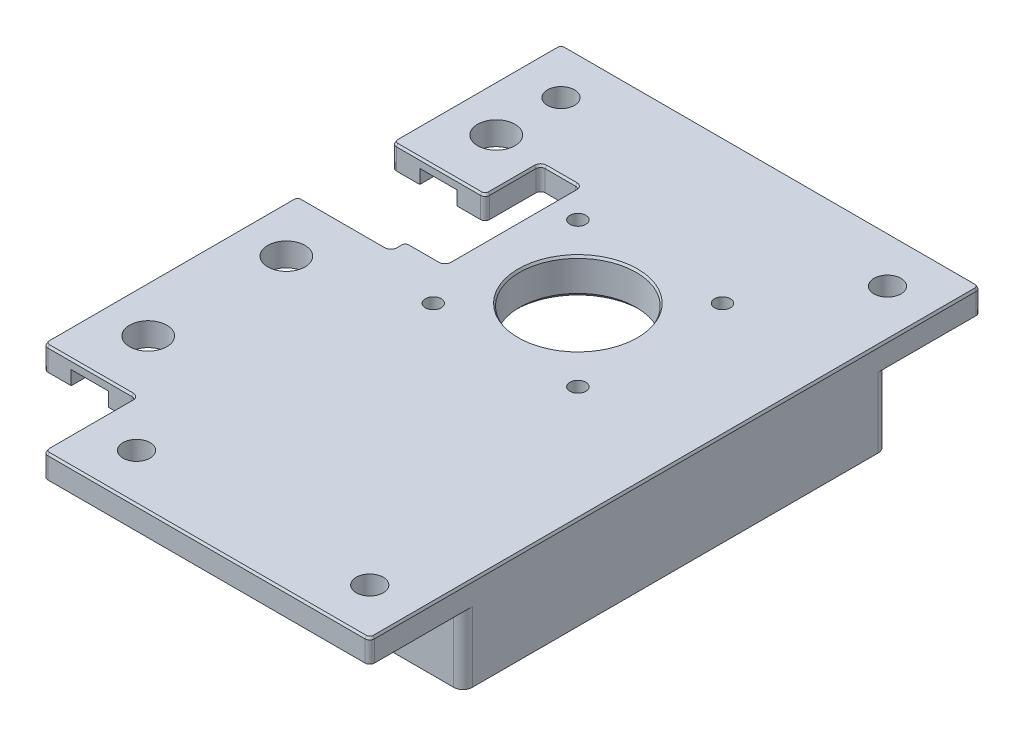
from build123d import *
from OCP.BRepFilletAPI import BRepFilletAPI_MakeChamfer

# Parameters (mm, degrees)
SKETCH1_W                  = 90
SKETCH1_H                  = 131
BOSS_EXTRUDE1_DEPTH        = 5
CUT_EXTRUDE1_REACH         = 161.016
SKETCH2_R                  = 12.5
SKETCH2_R_2                = 1.7
SKETCH2_W                  = 20
SKETCH2_H                  = 20
M5_CLEARANCE_HOLE1_D       = 5.8
SKETCH6_R                  = 4
CUT_EXTRUDE2_DEPTH         = 10
MOVE_FACE1_BY              = 0.1
MOVE_FACE1_2_BY            = 0.1
BOSS_EXTRUDE2_DEPTH        = 15
FILLET4_R                  = 3
FILLET5_R                  = 2
CUT_EXTRUDE5_DEPTH         = 4
CUT_EXTRUDE5_DEPTH_BACK    = 4
SKETCH11_W                 = 8.5
SKETCH11_H                 = 15
CUT_EXTRUDE6_DEPTH         = 161.190511579
FILLET6_R                  = 1
SKETCH15_R                 = 1.7
SKETCH15_R_2               = 12.5
BOSS_EXTRUDE3_DEPTH        = 3
CHAMFER1_SIZE              = 1
PRINTABILITY_CHAMFER_SIZE  = 0.5
PRINTABILITY_CHAMFER_SIZE2 = 0.288675135
SKETCH12_W                 = 0.325641026
SKETCH12_H                 = 1.221153846
LEFT_PART_NUM_DEPTH        = 0.4


# Some blends are built 0.0001 mm under size
with BuildPart() as part:
    # Sketch1 → Boss-Extrude1 (new body)
    with BuildSketch(Plane(origin=(0, 0, 0), x_dir=(1, 0, 0), z_dir=(0, 1, 0))):
        with Locations((45, 65.5)):
            Rectangle(SKETCH1_W, SKETCH1_H)
    extrude(amount=BOSS_EXTRUDE1_DEPTH)

    # Sketch2 → Cut-Extrude1 (cut, up to next)
    with BuildSketch(Plane(origin=(0, 5, 0), x_dir=(1, 0, 0), z_dir=(0, 1, 0)), mode=Mode.PRIVATE) as cut_extrude1_sk1:
        with Locations(Location((50, 84.625, 0), (0, 0, 270))):
            Circle(SKETCH2_R)
    cut_extrude1_tool1 = extrude(cut_extrude1_sk1.sketch, amount=-CUT_EXTRUDE1_REACH, mode=Mode.PRIVATE) & part.part
    # Sketch2 → Cut-Extrude1 (cut, up to next)
    with BuildSketch(Plane(origin=(0, 5, 0), x_dir=(1, 0, 0), z_dir=(0, 1, 0)), mode=Mode.PRIVATE) as cut_extrude1_sk2:
        with Locations(Location((65.5, 100.125, 0), (0, 0, 270))):
            Circle(SKETCH2_R_2)
    cut_extrude1_tool2 = extrude(cut_extrude1_sk2.sketch, amount=-CUT_EXTRUDE1_REACH, mode=Mode.PRIVATE) & part.part
    # Sketch2 → Cut-Extrude1 (cut, up to next)
    with BuildSketch(Plane(origin=(0, 5, 0), x_dir=(1, 0, 0), z_dir=(0, 1, 0)), mode=Mode.PRIVATE) as cut_extrude1_sk3:
        with Locations(Location((34.5, 100.125, 0), (0, 0, 270))):
            Circle(SKETCH2_R_2)
    cut_extrude1_tool3 = extrude(cut_extrude1_sk3.sketch, amount=-CUT_EXTRUDE1_REACH, mode=Mode.PRIVATE) & part.part
    # Sketch2 → Cut-Extrude1 (cut, up to next)
    with BuildSketch(Plane(origin=(0, 5, 0), x_dir=(1, 0, 0), z_dir=(0, 1, 0)), mode=Mode.PRIVATE) as cut_extrude1_sk4:
        with Locations(Location((65.5, 69.125, 0), (0, 0, 270))):
            Circle(SKETCH2_R_2)
    cut_extrude1_tool4 = extrude(cut_extrude1_sk4.sketch, amount=-CUT_EXTRUDE1_REACH, mode=Mode.PRIVATE) & part.part
    # Sketch2 → Cut-Extrude1 (cut, up to next)
    with BuildSketch(Plane(origin=(0, 5, 0), x_dir=(1, 0, 0), z_dir=(0, 1, 0)), mode=Mode.PRIVATE) as cut_extrude1_sk5:
        with Locations(Location((34.5, 69.125, 0), (0, 0, 270))):
            Circle(SKETCH2_R_2)
    cut_extrude1_tool5 = extrude(cut_extrude1_sk5.sketch, amount=-CUT_EXTRUDE1_REACH, mode=Mode.PRIVATE) & part.part
    # Sketch2 → Cut-Extrude1 (cut, up to next)
    with BuildSketch(Plane(origin=(0, 5, 0), x_dir=(1, 0, 0), z_dir=(0, 1, 0)), mode=Mode.PRIVATE) as cut_extrude1_sk6:
        Polygon((0, 94.625), (20, 94.625), (20, 91.625), (28.5, 91.625), (28.5, 77.625), (20, 77.625), (20, 74.625), (0, 74.625), align=None)
    cut_extrude1_tool6 = extrude(cut_extrude1_sk6.sketch, amount=-CUT_EXTRUDE1_REACH, mode=Mode.PRIVATE) & part.part
    # Sketch2 → Cut-Extrude1 (cut, up to next)
    with BuildSketch(Plane(origin=(0, 5, 0), x_dir=(1, 0, 0), z_dir=(0, 1, 0)), mode=Mode.PRIVATE) as cut_extrude1_sk7:
        with Locations((10, 10)):
            Rectangle(SKETCH2_W, SKETCH2_H)
    cut_extrude1_tool7 = extrude(cut_extrude1_sk7.sketch, amount=-CUT_EXTRUDE1_REACH, mode=Mode.PRIVATE) & part.part
    add(cut_extrude1_tool1.solids().sort_by_distance((50, 5, -84.625))[0], mode=Mode.SUBTRACT)
    add(cut_extrude1_tool2.solids().sort_by_distance((65.5, 5, -100.125))[0], mode=Mode.SUBTRACT)
    add(cut_extrude1_tool3.solids().sort_by_distance((34.5, 5, -100.125))[0], mode=Mode.SUBTRACT)
    add(cut_extrude1_tool4.solids().sort_by_distance((65.5, 5, -69.125))[0], mode=Mode.SUBTRACT)
    add(cut_extrude1_tool5.solids().sort_by_distance((34.5, 5, -69.125))[0], mode=Mode.SUBTRACT)
    add(cut_extrude1_tool6.solids().sort_by_distance((13.267341, 5, -84.625))[0], mode=Mode.SUBTRACT)
    add(cut_extrude1_tool7.solids().sort_by_distance((10, 5, -10))[0], mode=Mode.SUBTRACT)

    # M5 Clearance Hole1 (through all)
    with Locations(Plane(origin=(0, 5, 0), x_dir=(1, 0, 0), z_dir=(0, 1, 0))):
        with Locations((80, 10), (10, 121), (80, 121), (30, 10)):
            Hole(M5_CLEARANCE_HOLE1_D / 2)

    # Sketch6 → Cut-Extrude2 (cut)
    with BuildSketch(Plane(origin=(0, 0, 0), x_dir=(-1, 0, 0), z_dir=(0, -1, 0))):
        with Locations(Location((-10, 32.5, 0), (0, 0, 90))):
            Circle(SKETCH6_R)
        with Locations(Location((-10, 62.125, 0), (0, 0, 90))):
            Circle(SKETCH6_R)
        with Locations(Location((-10, 107.125, 0), (0, 0, 90))):
            Circle(SKETCH6_R)
    extrude(amount=-CUT_EXTRUDE2_DEPTH, mode=Mode.SUBTRACT)

    # Move Face1: a face moved inward by 0.1
    extrude(part.faces().sort_by_distance((10, 2.5, -94.625))[0], amount=MOVE_FACE1_BY, dir=(0, 0, -1), mode=Mode.SUBTRACT)

    # Move Face1 2: a face moved inward by 0.1
    extrude(part.faces().sort_by_distance((10, 2.5, -74.625))[0], amount=MOVE_FACE1_2_BY, dir=(0, 0, 1), mode=Mode.SUBTRACT)

    # Sketch9 → Boss-Extrude2 (add)
    with BuildSketch(Plane.XZ):
        Polygon((90, -111), (90, -20), (20, -20), (20, -74.525), (25, -74.525), (25, -25), (85, -25), (85, -106), (71, -106), (71, -111), align=None)
    extrude(amount=BOSS_EXTRUDE2_DEPTH)

    # Fillet4
    fillet4_edges = [part.edges().sort_by_distance(p)[0] for p in [
        (25, -7.5, -25),
        (85, -7.5, -25),
        (85, -7.5, -106),
    ]]
    fillet(fillet4_edges, radius=FILLET4_R)

    # Fillet5
    # the kernel refuses this fillet: 2 mm, written as the material it takes off along each edge
    with BuildSketch(Plane(origin=(71, 0, -111), x_dir=(0, 0, 1), z_dir=(0, -1, 0)), Plane(origin=(90, 0, -111), x_dir=(-1, 0, 0), z_dir=(0, -1, 0)), Plane(origin=(90, 0, -20), x_dir=(0, 0, -1), z_dir=(0, -1, 0)), Plane(origin=(20, 0, -20), x_dir=(1, 0, 0), z_dir=(0, -1, 0)), Plane(origin=(71, 0, -106), x_dir=(1, 0, 0), z_dir=(0, -1, 0))) as fillet5_piece_1:
        with BuildLine():
            CenterArc((FILLET5_R, -FILLET5_R), FILLET5_R, 90, 90)
            Line((0, -FILLET5_R), (0, 0))
            Line((0, 0), (FILLET5_R, 0))
        make_face()
    extrude(amount=20, mode=Mode.SUBTRACT)
    with BuildSketch(Plane(origin=(20, 0, -74.525), x_dir=(1, 0, 0), z_dir=(0, -1, 0)), Plane(origin=(25, 0, -74.525), x_dir=(0, 0, 1), z_dir=(0, -1, 0))) as fillet5_piece_2:
        with BuildLine():
            CenterArc((FILLET5_R, FILLET5_R), FILLET5_R, 180, 90)
            Line((0, FILLET5_R), (0, 0))
            Line((0, 0), (FILLET5_R, 0))
        make_face()
    extrude(amount=20, mode=Mode.SUBTRACT)

    # Sketch10 → Cut-Extrude5 (cut, two sides: drawn at the far end of the back side and taken through both)
    with BuildSketch(Plane.ZY.offset(-10).offset(-CUT_EXTRUDE5_DEPTH_BACK)):
        Polygon((-74.525, 0), (-74.525, 3), (-71.525, 0), align=None)
        Polygon((-97.725, 0), (-94.725, 0), (-94.725, 3), align=None)
        Polygon((-20, 0), (-23, 0), (-20, 3), align=None)
    extrude(amount=CUT_EXTRUDE5_DEPTH + CUT_EXTRUDE5_DEPTH_BACK, mode=Mode.SUBTRACT)

    # Sketch11 → Cut-Extrude6 (cut, through all)
    with BuildSketch(Plane(origin=(0, 5, 0), x_dir=(1, 0, 0), z_dir=(0, 1, 0))):
        with Locations((24.25, 99.125)):
            Rectangle(SKETCH11_W, SKETCH11_H)
    extrude(amount=-CUT_EXTRUDE6_DEPTH, mode=Mode.SUBTRACT)

    # Fillet6
    fillet6_edges = [part.edges().sort_by_distance(p)[0] for p in [
        (20, 2.5, -106.625),
        (28.5, 2.5, -106.625),
        (0, 2.5, -20),
        (20, 2.5, -20),
        (20, 2.5, 0),
        (0, 2.5, -74.525),
        (0, 2.5, -94.725),
        (20, 2.5, -94.725),
        (28.5, 2.5, -77.625),
        (20, 2.5, -77.625),
        (20, 2.5, -74.525),
        (0, 2.5, -131),
        (90, 2.5, -131),
        (90, 2.5, 0),
    ]]
    fillet(fillet6_edges, radius=FILLET6_R)

    # Sketch15 → Boss-Extrude3 (add)
    with BuildSketch(Plane.XZ):
        with BuildLine():
            Line((29.5, -100.125), (29.5, -69.125))
            ThreePointArc((29.5, -69.125), (30.964466094, -65.589466094), (34.5, -64.125))
            Line((34.5, -64.125), (65.5, -64.125))
            ThreePointArc((65.5, -64.125), (69.035533906, -65.589466094), (70.5, -69.125))
            Line((70.5, -69.125), (70.5, -100.125))
            ThreePointArc((70.5, -100.125), (69.035533906, -103.660533906), (65.5, -105.125))
            Line((65.5, -105.125), (34.5, -105.125))
            ThreePointArc((34.5, -105.125), (30.964466094, -103.660533906), (29.5, -100.125))
        make_face()
        with Locations(Location((65.5, -100.125, 0), (0, 0, 90))):
            Circle(SKETCH15_R, mode=Mode.SUBTRACT)
        with Locations(Location((34.5, -100.125, 0), (0, 0, 90))):
            Circle(SKETCH15_R, mode=Mode.SUBTRACT)
        with Locations(Location((65.5, -69.125, 0), (0, 0, 90))):
            Circle(SKETCH15_R, mode=Mode.SUBTRACT)
        with Locations(Location((34.5, -69.125, 0), (0, 0, 90))):
            Circle(SKETCH15_R, mode=Mode.SUBTRACT)
        with Locations(Location((50, -84.625, 0), (0, 0, 90))):
            Circle(SKETCH15_R_2, mode=Mode.SUBTRACT)
    extrude(amount=BOSS_EXTRUDE3_DEPTH)

    # Chamfer1
    chamfer1_edges = [part.edges().sort_by_distance(p)[0] for p in [
        (30.964466094, 0, -103.660533906),
        (50, 0, -105.125),
        (69.035533906, 0, -103.660533906),
        (70.5, 0, -84.625),
        (69.035533906, 0, -65.589466094),
        (50, 0, -64.125),
        (30.964466094, 0, -65.589466094),
        (29.5, 0, -84.625),
        (50, -3, -97.125),
    ]]
    chamfer(chamfer1_edges, length=CHAMFER1_SIZE - 0.0001)  # a hair under: the kernel refuses the full size

    # Printability Chamfer: one chamfer whose edges measure the first distance from different faces: ONE call of the kernel's chamfer builder (chamfer() names one face for all edges)
    printability_chamfer_edges_1 = [part.edges().sort_by_distance(p)[0] for p in [
        (24.25, 5, -77.625),
    ]]
    printability_chamfer_side_1 = [part.faces().sort_by_distance(p)[0] for p in [
        (24.25, 2.5, -77.625),
    ]]
    printability_chamfer_edges_2 = [part.edges().sort_by_distance(p)[0] for p in [
        (10, 5, -94.725),
    ]]
    printability_chamfer_side_2 = [part.faces().sort_by_distance(p)[0] for p in [
        (10, 4.813184583, -94.725),
    ]]
    printability_chamfer_edges_3 = [part.edges().sort_by_distance(p)[0] for p in [
        (20, 5, -100.675),
    ]]
    printability_chamfer_side_3 = [part.faces().sort_by_distance(p)[0] for p in [
        (20, 2.5, -100.675),
    ]]
    printability_chamfer_edges_4 = [part.edges().sort_by_distance(p)[0] for p in [
        (24.25, 5, -106.625),
    ]]
    printability_chamfer_side_4 = [part.faces().sort_by_distance(p)[0] for p in [
        (24.25, 2.5, -106.625),
    ]]
    printability_chamfer_edges_5 = [part.edges().sort_by_distance(p)[0] for p in [
        (28.5, 5, -92.125),
    ]]
    printability_chamfer_side_5 = [part.faces().sort_by_distance(p)[0] for p in [
        (28.5, 2.5, -92.125),
    ]]
    printability_chamfer_edges_6 = [part.edges().sort_by_distance(p)[0] for p in [
        (20, 5, -76.075),
    ]]
    printability_chamfer_side_6 = [part.faces().sort_by_distance(p)[0] for p in [
        (20, 2.5, -76.075),
    ]]
    printability_chamfer_edges_7 = [part.edges().sort_by_distance(p)[0] for p in [
        (10, 5, -74.525),
    ]]
    printability_chamfer_side_7 = [part.faces().sort_by_distance(p)[0] for p in [
        (10, 4.813184583, -74.525),
    ]]
    printability_chamfer_edges_8 = [part.edges().sort_by_distance(p)[0] for p in [
        (0, 5, -47.2625),
    ]]
    printability_chamfer_side_8 = [part.faces().sort_by_distance(p)[0] for p in [
        (0, 2.5, -47.2625),
    ]]
    printability_chamfer_edges_9 = [part.edges().sort_by_distance(p)[0] for p in [
        (10, 5, -20),
    ]]
    printability_chamfer_side_9 = [part.faces().sort_by_distance(p)[0] for p in [
        (10, 4.813184583, -20),
    ]]
    printability_chamfer_edges_10 = [part.edges().sort_by_distance(p)[0] for p in [
        (20, 5, -10),
    ]]
    printability_chamfer_side_10 = [part.faces().sort_by_distance(p)[0] for p in [
        (20, 2.5, -10),
    ]]
    printability_chamfer_edges_11 = [part.edges().sort_by_distance(p)[0] for p in [
        (55, 5, 0),
    ]]
    printability_chamfer_side_11 = [part.faces().sort_by_distance(p)[0] for p in [
        (55, 2.5, 0),
    ]]
    printability_chamfer_edges_12 = [part.edges().sort_by_distance(p)[0] for p in [
        (90, 5, -65.5),
    ]]
    printability_chamfer_side_12 = [part.faces().sort_by_distance(p)[0] for p in [
        (90, -4.192307692, -65.5),
    ]]
    printability_chamfer_edges_13 = [part.edges().sort_by_distance(p)[0] for p in [
        (45, 5, -131),
    ]]
    printability_chamfer_side_13 = [part.faces().sort_by_distance(p)[0] for p in [
        (45, 2.5, -131),
    ]]
    printability_chamfer_edges_14 = [part.edges().sort_by_distance(p)[0] for p in [
        (0, 5, -112.8625),
    ]]
    printability_chamfer_side_14 = [part.faces().sort_by_distance(p)[0] for p in [
        (0, 2.5, -112.8625),
    ]]
    printability_chamfer_edges_15 = [part.edges().sort_by_distance(p)[0] for p in [
        (20.292893219, 5, -0.292893219),
    ]]
    printability_chamfer_side_15 = [part.faces().sort_by_distance(p)[0] for p in [
        (20.292893219, 2.5, -0.292893219),
    ]]
    printability_chamfer_edges_16 = [part.edges().sort_by_distance(p)[0] for p in [
        (0.292893219, 5, -20.292893219),
    ]]
    printability_chamfer_side_16 = [part.faces().sort_by_distance(p)[0] for p in [
        (0.292893219, 2.5, -20.292893219),
    ]]
    printability_chamfer_edges_17 = [part.edges().sort_by_distance(p)[0] for p in [
        (0.292893219, 5, -74.232106781),
    ]]
    printability_chamfer_side_17 = [part.faces().sort_by_distance(p)[0] for p in [
        (0.292893219, 2.5, -74.232106781),
    ]]
    printability_chamfer_edges_18 = [part.edges().sort_by_distance(p)[0] for p in [
        (0.292893219, 5, -95.017893219),
    ]]
    printability_chamfer_side_18 = [part.faces().sort_by_distance(p)[0] for p in [
        (0.292893219, 2.5, -95.017893219),
    ]]
    printability_chamfer_edges_19 = [part.edges().sort_by_distance(p)[0] for p in [
        (0.292893219, 5, -130.707106781),
    ]]
    printability_chamfer_side_19 = [part.faces().sort_by_distance(p)[0] for p in [
        (0.292893219, 2.5, -130.707106781),
    ]]
    printability_chamfer_edges_20 = [part.edges().sort_by_distance(p)[0] for p in [
        (89.707106781, 5, -130.707106781),
    ]]
    printability_chamfer_side_20 = [part.faces().sort_by_distance(p)[0] for p in [
        (89.707106781, 2.5, -130.707106781),
    ]]
    printability_chamfer_edges_21 = [part.edges().sort_by_distance(p)[0] for p in [
        (89.707106781, 5, -0.292893219),
    ]]
    printability_chamfer_side_21 = [part.faces().sort_by_distance(p)[0] for p in [
        (89.707106781, 2.5, -0.292893219),
    ]]
    printability_chamfer_edges_22 = [part.edges().sort_by_distance(p)[0] for p in [
        (19.707106781, 5, -95.017893219),
    ]]
    printability_chamfer_side_22 = [part.faces().sort_by_distance(p)[0] for p in [
        (19.707106781, 2.5, -95.017893219),
    ]]
    printability_chamfer_edges_23 = [part.edges().sort_by_distance(p)[0] for p in [
        (20.292893219, 5, -77.332106781),
    ]]
    printability_chamfer_side_23 = [part.faces().sort_by_distance(p)[0] for p in [
        (20.292893219, 2.5, -77.332106781),
    ]]
    printability_chamfer_edges_24 = [part.edges().sort_by_distance(p)[0] for p in [
        (19.707106781, 5, -74.817893219),
    ]]
    printability_chamfer_side_24 = [part.faces().sort_by_distance(p)[0] for p in [
        (19.707106781, 2.5, -74.817893219),
    ]]
    printability_chamfer_edges_25 = [part.edges().sort_by_distance(p)[0] for p in [
        (28.207106781, 5, -77.917893219),
    ]]
    printability_chamfer_side_25 = [part.faces().sort_by_distance(p)[0] for p in [
        (28.207106781, 2.5, -77.917893219),
    ]]
    printability_chamfer_edges_26 = [part.edges().sort_by_distance(p)[0] for p in [
        (28.207106781, 5, -106.332106781),
    ]]
    printability_chamfer_side_26 = [part.faces().sort_by_distance(p)[0] for p in [
        (28.207106781, 2.5, -106.332106781),
    ]]
    printability_chamfer_edges_27 = [part.edges().sort_by_distance(p)[0] for p in [
        (20.292893219, 5, -106.332106781),
    ]]
    printability_chamfer_side_27 = [part.faces().sort_by_distance(p)[0] for p in [
        (20.292893219, 2.5, -106.332106781),
    ]]
    printability_chamfer_edges_28 = [part.edges().sort_by_distance(p)[0] for p in [
        (19.707106781, 5, -19.707106781),
    ]]
    printability_chamfer_side_28 = [part.faces().sort_by_distance(p)[0] for p in [
        (19.707106781, 2.5, -19.707106781),
    ]]
    printability_chamfer_edges_29 = [part.edges().sort_by_distance(p)[0] for p in [
        (50, 5, -97.125),
    ]]
    printability_chamfer_side_29 = [part.faces().sort_by_distance(p)[0] for p in [
        (50, 2.5, -97.125),
    ]]
    printability_chamfer = BRepFilletAPI_MakeChamfer(part.part.solid().wrapped)
    for e in printability_chamfer_edges_1:
        printability_chamfer.Add(PRINTABILITY_CHAMFER_SIZE, PRINTABILITY_CHAMFER_SIZE2, e.wrapped, printability_chamfer_side_1[0].wrapped)  # the first distance lies on this face
    for e in printability_chamfer_edges_2:
        printability_chamfer.Add(PRINTABILITY_CHAMFER_SIZE, PRINTABILITY_CHAMFER_SIZE2, e.wrapped, printability_chamfer_side_2[0].wrapped)  # the first distance lies on this face
    for e in printability_chamfer_edges_3:
        printability_chamfer.Add(PRINTABILITY_CHAMFER_SIZE, PRINTABILITY_CHAMFER_SIZE2, e.wrapped, printability_chamfer_side_3[0].wrapped)  # the first distance lies on this face
    for e in printability_chamfer_edges_4:
        printability_chamfer.Add(PRINTABILITY_CHAMFER_SIZE, PRINTABILITY_CHAMFER_SIZE2, e.wrapped, printability_chamfer_side_4[0].wrapped)  # the first distance lies on this face
    for e in printability_chamfer_edges_5:
        printability_chamfer.Add(PRINTABILITY_CHAMFER_SIZE, PRINTABILITY_CHAMFER_SIZE2, e.wrapped, printability_chamfer_side_5[0].wrapped)  # the first distance lies on this face
    for e in printability_chamfer_edges_6:
        printability_chamfer.Add(PRINTABILITY_CHAMFER_SIZE, PRINTABILITY_CHAMFER_SIZE2, e.wrapped, printability_chamfer_side_6[0].wrapped)  # the first distance lies on this face
    for e in printability_chamfer_edges_7:
        printability_chamfer.Add(PRINTABILITY_CHAMFER_SIZE, PRINTABILITY_CHAMFER_SIZE2, e.wrapped, printability_chamfer_side_7[0].wrapped)  # the first distance lies on this face
    for e in printability_chamfer_edges_8:
        printability_chamfer.Add(PRINTABILITY_CHAMFER_SIZE, PRINTABILITY_CHAMFER_SIZE2, e.wrapped, printability_chamfer_side_8[0].wrapped)  # the first distance lies on this face
    for e in printability_chamfer_edges_9:
        printability_chamfer.Add(PRINTABILITY_CHAMFER_SIZE, PRINTABILITY_CHAMFER_SIZE2, e.wrapped, printability_chamfer_side_9[0].wrapped)  # the first distance lies on this face
    for e in printability_chamfer_edges_10:
        printability_chamfer.Add(PRINTABILITY_CHAMFER_SIZE, PRINTABILITY_CHAMFER_SIZE2, e.wrapped, printability_chamfer_side_10[0].wrapped)  # the first distance lies on this face
    for e in printability_chamfer_edges_11:
        printability_chamfer.Add(PRINTABILITY_CHAMFER_SIZE, PRINTABILITY_CHAMFER_SIZE2, e.wrapped, printability_chamfer_side_11[0].wrapped)  # the first distance lies on this face
    for e in printability_chamfer_edges_12:
        printability_chamfer.Add(PRINTABILITY_CHAMFER_SIZE, PRINTABILITY_CHAMFER_SIZE2, e.wrapped, printability_chamfer_side_12[0].wrapped)  # the first distance lies on this face
    for e in printability_chamfer_edges_13:
        printability_chamfer.Add(PRINTABILITY_CHAMFER_SIZE, PRINTABILITY_CHAMFER_SIZE2, e.wrapped, printability_chamfer_side_13[0].wrapped)  # the first distance lies on this face
    for e in printability_chamfer_edges_14:
        printability_chamfer.Add(PRINTABILITY_CHAMFER_SIZE, PRINTABILITY_CHAMFER_SIZE2, e.wrapped, printability_chamfer_side_14[0].wrapped)  # the first distance lies on this face
    for e in printability_chamfer_edges_15:
        printability_chamfer.Add(PRINTABILITY_CHAMFER_SIZE, PRINTABILITY_CHAMFER_SIZE2, e.wrapped, printability_chamfer_side_15[0].wrapped)  # the first distance lies on this face
    for e in printability_chamfer_edges_16:
        printability_chamfer.Add(PRINTABILITY_CHAMFER_SIZE, PRINTABILITY_CHAMFER_SIZE2, e.wrapped, printability_chamfer_side_16[0].wrapped)  # the first distance lies on this face
    for e in printability_chamfer_edges_17:
        printability_chamfer.Add(PRINTABILITY_CHAMFER_SIZE, PRINTABILITY_CHAMFER_SIZE2, e.wrapped, printability_chamfer_side_17[0].wrapped)  # the first distance lies on this face
    for e in printability_chamfer_edges_18:
        printability_chamfer.Add(PRINTABILITY_CHAMFER_SIZE, PRINTABILITY_CHAMFER_SIZE2, e.wrapped, printability_chamfer_side_18[0].wrapped)  # the first distance lies on this face
    for e in printability_chamfer_edges_19:
        printability_chamfer.Add(PRINTABILITY_CHAMFER_SIZE, PRINTABILITY_CHAMFER_SIZE2, e.wrapped, printability_chamfer_side_19[0].wrapped)  # the first distance lies on this face
    for e in printability_chamfer_edges_20:
        printability_chamfer.Add(PRINTABILITY_CHAMFER_SIZE, PRINTABILITY_CHAMFER_SIZE2, e.wrapped, printability_chamfer_side_20[0].wrapped)  # the first distance lies on this face
    for e in printability_chamfer_edges_21:
        printability_chamfer.Add(PRINTABILITY_CHAMFER_SIZE, PRINTABILITY_CHAMFER_SIZE2, e.wrapped, printability_chamfer_side_21[0].wrapped)  # the first distance lies on this face
    for e in printability_chamfer_edges_22:
        printability_chamfer.Add(PRINTABILITY_CHAMFER_SIZE, PRINTABILITY_CHAMFER_SIZE2, e.wrapped, printability_chamfer_side_22[0].wrapped)  # the first distance lies on this face
    for e in printability_chamfer_edges_23:
        printability_chamfer.Add(PRINTABILITY_CHAMFER_SIZE, PRINTABILITY_CHAMFER_SIZE2, e.wrapped, printability_chamfer_side_23[0].wrapped)  # the first distance lies on this face
    for e in printability_chamfer_edges_24:
        printability_chamfer.Add(PRINTABILITY_CHAMFER_SIZE, PRINTABILITY_CHAMFER_SIZE2, e.wrapped, printability_chamfer_side_24[0].wrapped)  # the first distance lies on this face
    for e in printability_chamfer_edges_25:
        printability_chamfer.Add(PRINTABILITY_CHAMFER_SIZE, PRINTABILITY_CHAMFER_SIZE2, e.wrapped, printability_chamfer_side_25[0].wrapped)  # the first distance lies on this face
    for e in printability_chamfer_edges_26:
        printability_chamfer.Add(PRINTABILITY_CHAMFER_SIZE, PRINTABILITY_CHAMFER_SIZE2, e.wrapped, printability_chamfer_side_26[0].wrapped)  # the first distance lies on this face
    for e in printability_chamfer_edges_27:
        printability_chamfer.Add(PRINTABILITY_CHAMFER_SIZE, PRINTABILITY_CHAMFER_SIZE2, e.wrapped, printability_chamfer_side_27[0].wrapped)  # the first distance lies on this face
    for e in printability_chamfer_edges_28:
        printability_chamfer.Add(PRINTABILITY_CHAMFER_SIZE, PRINTABILITY_CHAMFER_SIZE2, e.wrapped, printability_chamfer_side_28[0].wrapped)  # the first distance lies on this face
    for e in printability_chamfer_edges_29:
        printability_chamfer.Add(PRINTABILITY_CHAMFER_SIZE, PRINTABILITY_CHAMFER_SIZE2, e.wrapped, printability_chamfer_side_29[0].wrapped)  # the first distance lies on this face
    add(Compound.cast(printability_chamfer.Shape()), mode=Mode.REPLACE)

    # Sketch12 → Left Part Num (cut)
    # profile 1 of 6: a face of its own
    with BuildSketch(Plane(origin=(0, 5, 0), x_dir=(0, -1, 0), z_dir=(1, 0, 0))):
        Polygon((1.225, 119.008974359), (1.225, 118.724038462), (4.074358974, 118.724038462), (4.074358974, 117.502884615), (4.4, 117.502884615), (4.4, 119.008974359), align=None)
    # profile 2 of 6: a face of its own
    with BuildSketch(Plane(origin=(0, 5, 0), x_dir=(0, -1, 0), z_dir=(1, 0, 0))):
        Polygon((1.550641026, 117.136538462), (1.225, 117.136538462), (1.225, 115.467628205), (4.074358974, 116.799449119), (4.074358974, 115.508333333), (4.4, 115.508333333), (4.4, 117.258653846), (1.550641026, 115.926832933), align=None)
    # profile 3 of 6: a face of its own
    with BuildSketch(Plane(origin=(0, 5, 0), x_dir=(0, -1, 0), z_dir=(1, 0, 0))):
        with BuildLine():
            Line((1.225, 114.857051282), (1.225, 114.234390024))
            add(Edge.make_bspline(
                [(1.225, 114.234390024), (1.225047077, 114.191562988), (1.22513728, 114.109504484), (1.227872085, 113.991834398), (1.23152487, 113.884964141), (1.236588444, 113.789124153), (1.242572494, 113.70401955), (1.250965415, 113.630035428), (1.259728683, 113.566590259), (1.268638102, 113.528575123), (1.272701322, 113.511237981)],
                knots=[0, 0, 0, 0, 1.415646017, 2.712440637, 3.8905458, 4.950247383, 5.884950622, 6.709939814, 7.411656543, 8, 8, 8, 8], degree=3))
            add(Edge.make_bspline(
                [(1.272701322, 113.511237981), (1.278708612, 113.489291181), (1.290581636, 113.44591473), (1.314357828, 113.383408871), (1.342566417, 113.32395245), (1.374654318, 113.267280097), (1.412201045, 113.214424009), (1.452708774, 113.163622198), (1.498795287, 113.116667965), (1.549007001, 113.072925322), (1.602707076, 113.03249521), (1.660871173, 112.998526606), (1.721762778, 112.968825517), (1.786209458, 112.944507727), (1.854273783, 112.926424009), (1.925472044, 112.91299867), (1.999884302, 112.904438178), (2.050739294, 112.903621081), (2.076627604, 112.903205128)],
                knots=[0, 0, 0, 0, 0.999549623, 1.97554611, 2.93413192, 3.889860808, 4.833293765, 5.780583482, 6.742559327, 7.719844669, 8.705620613, 9.691528643, 10.674968152, 11.680406189, 12.713313868, 13.765869198, 14.862690416, 16, 16, 16, 16], degree=3))
            add(Edge.make_bspline(
                [(2.076627604, 112.903205128), (2.102733159, 112.903587421), (2.15381044, 112.904335402), (2.228534326, 112.913312746), (2.299943151, 112.925405134), (2.367878582, 112.943998889), (2.431937173, 112.968351749), (2.493097862, 112.99691954), (2.550320136, 113.031376029), (2.603811736, 113.070968124), (2.65362287, 113.115011356), (2.699392577, 113.163319379), (2.740852941, 113.215697165), (2.77809691, 113.271978257), (2.810260821, 113.332711334), (2.839069233, 113.396975288), (2.863263695, 113.465328698), (2.875990965, 113.512629407), (2.882461939, 113.536678686)],
                knots=[0, 0, 0, 0, 1.121902311, 2.195077645, 3.232258892, 4.234102512, 5.217864754, 6.176164875, 7.132989551, 8.084763148, 9.034132444, 9.988522005, 10.94243251, 11.903244335, 12.886203696, 13.894208494, 14.929344452, 16, 16, 16, 16], degree=3))
            add(Edge.make_bspline(
                [(2.882461939, 113.536678686), (2.886688777, 113.556570137), (2.895952137, 113.600163408), (2.906363894, 113.671952662), (2.914902673, 113.755579098), (2.922871129, 113.850758182), (2.927093415, 113.95771187), (2.932051068, 114.07619486), (2.934390313, 114.206608141), (2.934538182, 114.297567338), (2.934615385, 114.345057091)],
                knots=[0, 0, 0, 0, 0.601372724, 1.317943291, 2.144091499, 3.08771165, 4.142394186, 5.309582461, 6.595334295, 8, 8, 8, 8], degree=3))
            Line((2.934615385, 114.345057091), (2.934615385, 114.572115385))
            Line((2.934615385, 114.572115385), (4.4, 114.572115385))
            Line((4.4, 114.572115385), (4.4, 114.857051282))
            Line((4.4, 114.857051282), (1.225, 114.857051282))
        make_face()
        with BuildLine():
            Line((1.550641026, 114.572115385), (2.608974359, 114.572115385))
            Line((2.608974359, 114.572115385), (2.615970553, 114.016235978))
            add(Edge.make_bspline(
                [(2.615970553, 114.016235978), (2.615985499, 113.989094141), (2.616014351, 113.936697384), (2.612386906, 113.861011349), (2.608255232, 113.790781452), (2.602006315, 113.726271788), (2.593814974, 113.667256005), (2.583628222, 113.614243855), (2.572553603, 113.566442455), (2.554050661, 113.511456204), (2.52560049, 113.449649847), (2.484184919, 113.382131119), (2.430533025, 113.325352891), (2.370377908, 113.27630988), (2.303638042, 113.23662506), (2.231854759, 113.208629002), (2.15609152, 113.191390186), (2.104279906, 113.189237223), (2.077899639, 113.188141026)],
                knots=[0, 0, 0, 0, 1.160746174, 2.240796558, 3.240300023, 4.169675897, 5.012224395, 5.787635701, 6.478238024, 7.109103438, 8.265591281, 9.382545711, 10.479929969, 11.588830844, 12.694575677, 13.785760505, 14.872603606, 16, 16, 16, 16], degree=3))
            add(Edge.make_bspline(
                [(2.077899639, 113.188141026), (2.052374013, 113.189286438), (2.001632227, 113.191563375), (1.927265411, 113.208486741), (1.856295855, 113.236925685), (1.790093455, 113.276344575), (1.730070703, 113.324197387), (1.677840367, 113.379771798), (1.636133187, 113.443209982), (1.608176743, 113.501730206), (1.591809231, 113.554134347), (1.579987574, 113.599427817), (1.571835727, 113.650830609), (1.564035425, 113.707854317), (1.557739026, 113.770426543), (1.553366565, 113.83894498), (1.550834446, 113.913181454), (1.55070706, 113.964716516), (1.550641026, 113.99143129)],
                knots=[0, 0, 0, 0, 1.120540835, 2.227496496, 3.330685923, 4.466139262, 5.598993257, 6.692710361, 7.80064471, 8.921224235, 9.527843361, 10.209888745, 10.975318552, 11.811557897, 12.738105936, 13.73658638, 14.826690375, 16, 16, 16, 16], degree=3))
            Line((1.550641026, 113.99143129), (1.550641026, 114.572115385))
        make_face(mode=Mode.SUBTRACT)
    # profile 4 of 6: a face of its own
    with BuildSketch(Plane(origin=(0, 5, 0), x_dir=(0, -1, 0), z_dir=(1, 0, 0))):
        with Locations((3.178846154, 111.926282051)):
            Rectangle(SKETCH12_W, SKETCH12_H)
    # profile 5 of 6: a face of its own
    with BuildSketch(Plane(origin=(0, 5, 0), x_dir=(0, -1, 0), z_dir=(1, 0, 0))):
        with BuildLine():
            add(Edge.make_bspline(
                [(2.813772035, 111.071474359), (2.762883691, 111.0711768), (2.664032348, 111.070598786), (2.519991994, 111.064168576), (2.384863732, 111.053486658), (2.258641094, 111.038847755), (2.141291491, 111.021033304), (2.03312854, 110.997252106), (1.933651586, 110.970207658), (1.842536383, 110.938863576), (1.758554894, 110.903496348), (1.680155901, 110.86500147), (1.607452134, 110.821856746), (1.539304243, 110.776508608), (1.476753039, 110.727191657), (1.419077814, 110.674963343), (1.366764954, 110.618779092), (1.319778634, 110.559183841), (1.278578488, 110.496581494), (1.242064493, 110.432682739), (1.211988111, 110.366345847), (1.187384802, 110.298444106), (1.167300553, 110.228834405), (1.153504732, 110.157534516), (1.144839858, 110.084379158), (1.144010402, 110.03500236), (1.143589744, 110.009960938)],
                knots=[0, 0, 0, 0, 1.646148282, 3.197666765, 4.66315463, 6.030252048, 7.307778049, 8.501004361, 9.610818041, 10.641065266, 11.615491391, 12.557119604, 13.464013759, 14.348536654, 15.203310953, 16.038349431, 16.863300206, 17.683791446, 18.490318933, 19.285717724, 20.06220424, 20.843281102, 21.620494212, 22.403315558, 23.190242141, 24, 24, 24, 24], degree=3))
            add(Edge.make_bspline(
                [(1.143589744, 110.009960938), (1.143940127, 109.984697936), (1.144637268, 109.934433455), (1.15444994, 109.860387785), (1.16711544, 109.787631864), (1.187428816, 109.717269544), (1.211736404, 109.647970407), (1.243809882, 109.581457785), (1.278692279, 109.51538343), (1.321245869, 109.452749012), (1.368274589, 109.391683128), (1.421664209, 109.334440239), (1.479937166, 109.279557061), (1.544393116, 109.229106511), (1.61404376, 109.18092635), (1.68947297, 109.136845544), (1.770513584, 109.095947293), (1.856789911, 109.057462819), (1.950606524, 109.023809162), (2.051378265, 108.993888372), (2.16001767, 108.969363221), (2.275919549, 108.949081352), (2.399658079, 108.933338761), (2.530982551, 108.92188157), (2.669975122, 108.91582744), (2.765005487, 108.91468753), (2.813772035, 108.914102564)],
                knots=[0, 0, 0, 0, 0.810910589, 1.61342667, 2.396193133, 3.181089899, 3.963115317, 4.752255436, 5.550715454, 6.36105385, 7.181178335, 8.024612154, 8.872680183, 9.750181803, 10.651284446, 11.591556747, 12.554036451, 13.566402641, 14.62422919, 15.753422176, 16.94128843, 18.199818041, 19.531985927, 20.947085226, 22.433341622, 24, 24, 24, 24], degree=3))
            add(Edge.make_bspline(
                [(2.813772035, 108.914102564), (2.862325441, 108.914700399), (2.957141539, 108.915867864), (3.095515231, 108.921751726), (3.226131835, 108.933618608), (3.349130608, 108.948246033), (3.464568578, 108.96875459), (3.572370524, 108.993465705), (3.672918116, 109.021620346), (3.765490942, 109.055790496), (3.851617553, 109.093379213), (3.932062281, 109.134233577), (4.007471571, 109.178065628), (4.077305929, 109.225523199), (4.141503164, 109.276803608), (4.199975986, 109.331648318), (4.253705187, 109.389391005), (4.301252024, 109.450812892), (4.344129596, 109.514030711), (4.380277855, 109.580111779), (4.411598201, 109.647364902), (4.437205473, 109.71646154), (4.457064212, 109.787295011), (4.470716013, 109.8601008), (4.48031218, 109.934443904), (4.481042964, 109.984701431), (4.481410256, 110.009960938)],
                knots=[0, 0, 0, 0, 1.561645053, 3.049612875, 4.452756685, 5.778837748, 7.032101753, 8.221335837, 9.334924186, 10.387562255, 11.392109817, 12.355697819, 13.287721948, 14.19548756, 15.068665045, 15.927346723, 16.771751757, 17.602390507, 18.423119567, 19.225778204, 20.022010933, 20.807278863, 21.593079439, 22.384715467, 23.188155646, 24, 24, 24, 24], degree=3))
            add(Edge.make_bspline(
                [(4.481410256, 110.009960938), (4.480987205, 110.035001812), (4.480153031, 110.08437753), (4.471522718, 110.157540802), (4.457647511, 110.22855416), (4.438219593, 110.297768033), (4.414438985, 110.365537504), (4.383456742, 110.430939176), (4.347775018, 110.494699992), (4.307139569, 110.556650777), (4.260581952, 110.615623846), (4.209094419, 110.67196472), (4.151356655, 110.724205913), (4.08827768, 110.773095242), (4.020028397, 110.818922791), (3.946563005, 110.861694688), (3.86775606, 110.900996833), (3.783110858, 110.936968303), (3.69134896, 110.968861025), (3.591618431, 110.996923506), (3.482906305, 111.019336148), (3.365764536, 111.038334327), (3.2399551, 111.053557816), (3.105432482, 111.06416414), (2.962452128, 111.070593905), (2.864236452, 111.071175519), (2.813772035, 111.071474359)],
                knots=[0, 0, 0, 0, 0.810927267, 1.598990287, 2.382942141, 3.152806972, 3.926217614, 4.706701772, 5.493896336, 6.292070767, 7.104102563, 7.925577746, 8.761822141, 9.623241997, 10.509042271, 11.423174113, 12.375371989, 13.360203808, 14.400680605, 15.520553799, 16.714061498, 17.994519714, 19.364400916, 20.818312473, 22.365209998, 24, 24, 24, 24], degree=3))
        make_face()
        with BuildLine():
            add(Edge.make_bspline(
                [(2.8125, 110.786538462), (2.854907579, 110.78642773), (2.937212362, 110.786212822), (3.056603995, 110.780760977), (3.168147671, 110.773172565), (3.271799856, 110.763625907), (3.367198289, 110.749328428), (3.454739575, 110.733107063), (3.534261677, 110.713650527), (3.606459525, 110.69051644), (3.672355467, 110.664164464), (3.733705866, 110.635443254), (3.791237837, 110.604315096), (3.8448118, 110.570141933), (3.893772872, 110.532248137), (3.939362103, 110.492390468), (3.979993941, 110.44877336), (4.028733605, 110.388447647), (4.079096573, 110.308802436), (4.12295363, 110.208454263), (4.150514796, 110.105340643), (4.154019783, 110.035353451), (4.155769231, 110.000420673)],
                knots=[0, 0, 0, 0, 1.459098681, 2.831824031, 4.11146945, 5.306290378, 6.412266529, 7.42953815, 8.369053297, 9.227277979, 10.03601793, 10.809473603, 11.557037441, 12.285528272, 12.993193355, 13.685654407, 14.36688038, 15.041354379, 16.352855396, 17.594313975, 18.799247529, 20, 20, 20, 20], degree=3))
            add(Edge.make_bspline(
                [(4.155769231, 110.000420673), (4.15423738, 109.965285683), (4.151179113, 109.895140335), (4.124487765, 109.792121436), (4.081096109, 109.692937623), (4.031522171, 109.614662809), (3.984009028, 109.555277973), (3.943546211, 109.512714019), (3.898226589, 109.473651573), (3.849332926, 109.436601703), (3.795926979, 109.402621047), (3.738266698, 109.371720893), (3.676191642, 109.343523862), (3.632857667, 109.327459227), (3.610702123, 109.319245793)],
                knots=[0, 0, 0, 0, 1.353621445, 2.702441307, 4.075953605, 5.516772412, 6.261413105, 7.007624062, 7.778524365, 8.566925914, 9.372323995, 10.217594641, 11.088702136, 12, 12, 12, 12], degree=3))
            add(Edge.make_bspline(
                [(3.610702123, 109.319245793), (3.582372288, 109.309673832), (3.524850574, 109.290238647), (3.435620689, 109.265190823), (3.342001039, 109.24546464), (3.244551112, 109.227717872), (3.14255224, 109.215604743), (3.03632002, 109.205854941), (2.925774356, 109.200112103), (2.850667471, 109.199400222), (2.8125, 109.199038462)],
                knots=[0, 0, 0, 0, 0.884706709, 1.796334032, 2.740027952, 3.714592787, 4.726048262, 5.777819803, 6.87074269, 8, 8, 8, 8], degree=3))
            add(Edge.make_bspline(
                [(2.8125, 109.199038462), (2.774338702, 109.199537562), (2.699687045, 109.200513909), (2.590359839, 109.204245883), (2.486521227, 109.213882983), (2.38772387, 109.22458647), (2.294514665, 109.240368232), (2.206113324, 109.25738425), (2.123614983, 109.280245325), (2.045728166, 109.304665493), (1.973337263, 109.332614623), (1.90610654, 109.363382077), (1.84370523, 109.396236755), (1.786326138, 109.431938481), (1.733636439, 109.469989967), (1.686848519, 109.511755524), (1.643686403, 109.55458273), (1.595298485, 109.615492045), (1.545571911, 109.694584644), (1.501055337, 109.793681435), (1.474709227, 109.896242343), (1.471055605, 109.965719602), (1.469230769, 110.000420673)],
                knots=[0, 0, 0, 0, 1.313483664, 2.569454835, 3.763100662, 4.901599063, 5.988328865, 7.015709358, 7.99797933, 8.932480776, 9.824041341, 10.666387587, 11.475829342, 12.24921787, 12.990555181, 13.709176526, 14.405678811, 15.080244297, 16.38186033, 17.610124501, 18.806354173, 20, 20, 20, 20], degree=3))
            add(Edge.make_bspline(
                [(1.469230769, 110.000420673), (1.471060145, 110.035542045), (1.47472223, 110.10584877), (1.500933494, 110.209504932), (1.545441664, 110.309271183), (1.595202681, 110.3886246), (1.643500879, 110.448793969), (1.684608206, 110.491491564), (1.72910856, 110.531902005), (1.778503972, 110.568814546), (1.831889166, 110.602785072), (1.888677149, 110.635116221), (1.95014218, 110.663453354), (2.015986452, 110.689889932), (2.08818827, 110.713062606), (2.167998111, 110.732296829), (2.255748452, 110.749807316), (2.35184392, 110.76241772), (2.455518227, 110.773522018), (2.567347158, 110.78067767), (2.687148771, 110.786237797), (2.769879385, 110.786436233), (2.8125, 110.786538462)],
                knots=[0, 0, 0, 0, 1.207546505, 2.417292871, 3.651582144, 4.952510111, 5.626719005, 6.30238548, 6.989136872, 7.692112372, 8.420316868, 9.164734959, 9.937886623, 10.746308695, 11.604196049, 12.543341915, 13.568754172, 14.680483261, 15.875568977, 17.154711427, 18.534182925, 20, 20, 20, 20], degree=3))
        make_face(mode=Mode.SUBTRACT)
    # profile 6 of 6: a face of its own
    with BuildSketch(Plane(origin=(0, 5, 0), x_dir=(0, -1, 0), z_dir=(1, 0, 0))):
        Polygon((1.143589744, 106.89601863), (1.143589744, 106.838141026), (3.341666667, 106.838141026), (3.341666667, 106.471794872), (3.667307692, 106.471794872), (3.667307692, 106.838141026), (4.4, 106.838141026), (4.4, 107.123076923), (3.667307692, 107.123076923), (3.667307692, 108.629166667), align=None)
        Polygon((3.341666667, 107.123076923), (1.962780449, 107.123076923), (3.341666667, 108.069471154), align=None, mode=Mode.SUBTRACT)
    extrude(amount=LEFT_PART_NUM_DEPTH, mode=Mode.SUBTRACT)


solid = part.part
